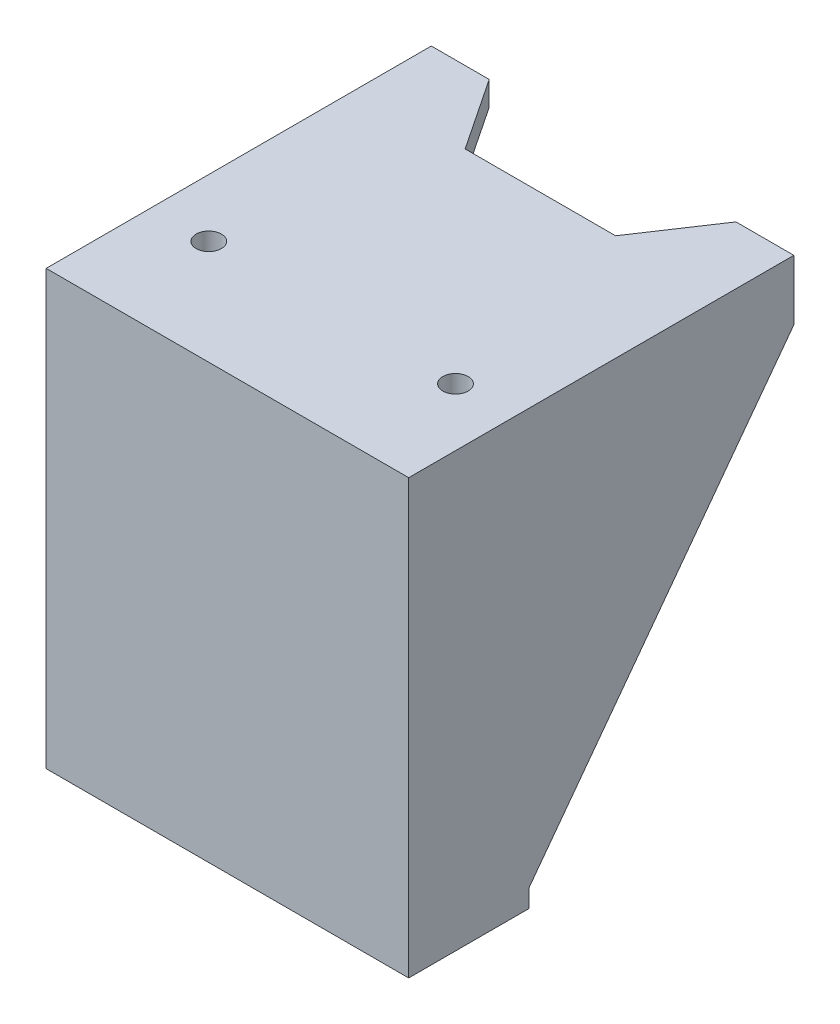
from build123d import *

# Parameters (mm, degrees)
BOSS_EXTRUDE1_DEPTH = 32.5
SKETCH4_R           = 1.05
BOSS_EXTRUDE2_DEPTH = 1.5
SKETCH5_R           = 1.05
BOSS_EXTRUDE3_DEPTH = 2
CUT_EXTRUDE1_DEPTH  = 56.871145361


with BuildPart() as part:
    # Sketch2 → Boss-Extrude1 (new body)
    with BuildSketch(Plane(origin=(0, 0, 0), x_dir=(1, 0, 0), z_dir=(0, 1, 0))):
        Polygon((15.061, 0), (15.061, 32), (12.561, 32), (12.561, 2.5), (-12.561, 2.5), (-12.561, 32), (-15.061, 32), (-15.061, 0), align=None)
    extrude(amount=BOSS_EXTRUDE1_DEPTH)

    # Sketch4 → Boss-Extrude2 (add)
    with BuildSketch(Plane.XZ):
        Polygon((-7.5, -6), (7.5, -6), (12.561, -10), (15.061, -10), (15.061, 0), (-15.061, 0), (-15.061, -10), (-12.561, -10), align=None)
        with Locations((-10.2499, -4.95)):
            Circle(SKETCH4_R, mode=Mode.SUBTRACT)
        with Locations((10.2499, -4.95)):
            Circle(SKETCH4_R, mode=Mode.SUBTRACT)
    extrude(amount=BOSS_EXTRUDE2_DEPTH)

    # Sketch5 → Boss-Extrude3 (add)
    with BuildSketch(Plane(origin=(0, 32.5, 0), x_dir=(1, 0, 0), z_dir=(0, 1, 0))):
        Polygon((-15.061, 32), (-10.2499, 32), (-6.25, 26), (6.25, 26), (10.2499, 32), (15.061, 32), (15.061, 0), (-15.061, 0), align=None)
        with Locations((-10.2499, 8.7)):
            Circle(SKETCH5_R, mode=Mode.SUBTRACT)
        with Locations((10.2499, 8.7)):
            Circle(SKETCH5_R, mode=Mode.SUBTRACT)
    extrude(amount=BOSS_EXTRUDE3_DEPTH)

    # Sketch6 → Cut-Extrude1 (cut, through all)
    with BuildSketch(Plane.ZY.offset(15.061)):
        Polygon((-10, 0), (-32, 29.5), (-32, 0), align=None)
    extrude(amount=-CUT_EXTRUDE1_DEPTH, mode=Mode.SUBTRACT)


solid = part.part
